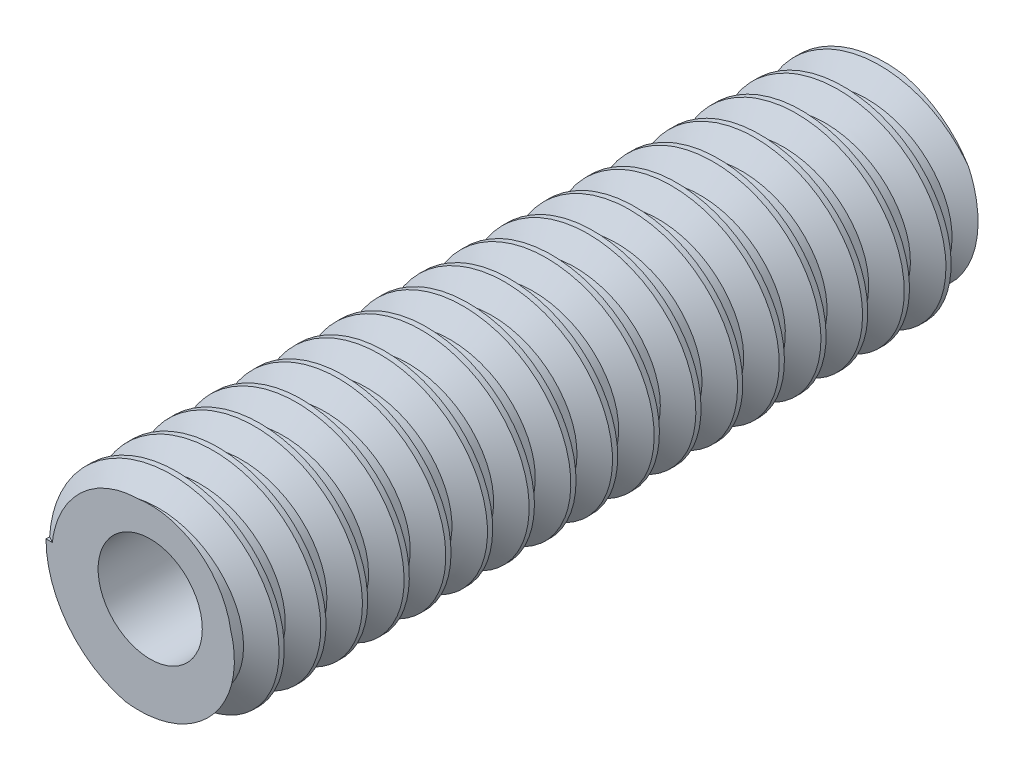
from build123d import *

# Parameters (mm, degrees)
SKETCH1_R           = 3.175
BOSS_EXTRUDE1_DEPTH = 22.225
THREAD1_PITCH       = 1.27
SKETCH5_R           = 1.5875
CUT_EXTRUDE1_DEPTH  = 19.05


with BuildPart() as part:
    # Sketch1 → Boss-Extrude1 (new body)
    with BuildSketch(Plane.XY):
        Circle(SKETCH1_R)
    extrude(amount=BOSS_EXTRUDE1_DEPTH)

    # Thread1: the profile of Thread Profile1 profile screwed along a right-hand helix of 30 turns, 8 arcs to a turn; built about Z, then put on its axis
    thread1_z = Axis((0, 0, 0), (0, 0, 1))
    thread1_corners = [(3.1753, 0, -0.000173205), (3.1753, 0, 1.111423202), (2.487592339, 0, 0.714374998), (2.487592339, 0, 0.396874998)]
    with BuildLine(mode=Mode.PRIVATE) as thread1_profile:
        Line(thread1_corners[0], thread1_corners[1])
        Line(thread1_corners[1], thread1_corners[2])
        Line(thread1_corners[2], thread1_corners[3])
        Line(thread1_corners[3], thread1_corners[0])
    thread1_cap = Face(thread1_profile.wire())
    thread1_turn_angles = [0, 22.5, 45, 67.5, 90, 112.5, 135, 157.5, 180, 202.5, 225, 247.5, 270, 292.5, 315, 337.5, 360]
    thread1_turn_weights = [1, 0.9238795325112867, 1, 0.9238795325112867, 1, 0.9238795325112867, 1, 0.9238795325112867, 1, 0.9238795325112867, 1, 0.9238795325112867, 1, 0.9238795325112867, 1, 0.9238795325112867, 1]
    thread1_turn_rails = [Edge.make_bspline([Vector(p[0], p[1], 0).rotate(thread1_z, thread1_turn_angles[k]) / thread1_turn_weights[k] + Vector(0, 0, p[2] + THREAD1_PITCH * thread1_turn_angles[k] / 360) for k in range(17)], [0, 0, 0, 1, 1, 2, 2, 3, 3, 4, 4, 5, 5, 6, 6, 7, 7, 8, 8, 8], 2, thread1_turn_weights) for p in thread1_corners]
    thread1_turn_sides = [Face.make_surface_from_curves(thread1_turn_rails[p[0]], thread1_turn_rails[p[1]]) for p in [(0, 1), (1, 2), (2, 3), (3, 0)]]
    thread1 = Plane(origin=(0, 0, 23.225), x_dir=(-1, 0, 0), z_dir=(0, 0, -1)) * Solid(Shell([*[p.moved(Location((0, 0, THREAD1_PITCH * i))) for i in range(30) for p in thread1_turn_sides], thread1_cap, thread1_cap.rotate(thread1_z, 10800).moved(Location((0, 0, THREAD1_PITCH * 10800 / 360)))]))
    add(thread1, mode=Mode.SUBTRACT)

    # Sketch5 → Cut-Extrude1 (cut)
    with BuildSketch(Plane.XY.offset(22.225)):
        Circle(SKETCH5_R)
    extrude(amount=-CUT_EXTRUDE1_DEPTH, mode=Mode.SUBTRACT)


solid = part.part
